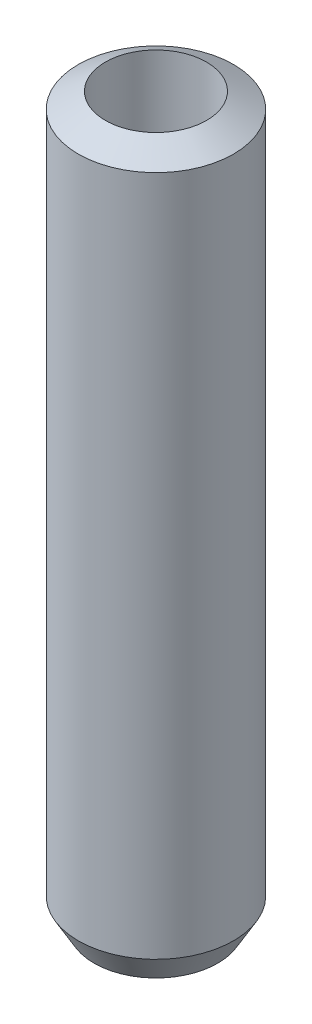
from build123d import *

# Parameters (mm, degrees)
SKETCH1_R           = 7.5
BOSS_EXTRUDE1_DEPTH = 69.977346
SKETCH2_R           = 4.887771224
CUT_EXTRUDE1_DEPTH  = 71.776613039
CHAMFER1_SIZE       = 1.524616
CHAMFER1_SIZE_2     = 2.640712


with BuildPart() as part:
    # Sketch1 → Boss-Extrude1 (new body)
    with BuildSketch(Plane(origin=(0, 0, 0), x_dir=(1, 0, 0), z_dir=(0, 1, 0))):
        with Locations(Location((0, 0, 0), (0, 0, 270))):
            Circle(SKETCH1_R)
    extrude(amount=BOSS_EXTRUDE1_DEPTH)

    # Sketch2 → Cut-Extrude1 (cut, through all)
    with BuildSketch(Plane(origin=(0, 0, 0), x_dir=(1, 0, 0), z_dir=(0, 1, 0))):
        with Locations(Location((0, 0, 0), (0, 0, 270))):
            Circle(SKETCH2_R)
    extrude(amount=CUT_EXTRUDE1_DEPTH, mode=Mode.SUBTRACT)

    # Chamfer1
    # the kernel refuses this chamfer: 2.640712, 1.524616 mm, written as the material it takes off along each edge
    with BuildSketch(Plane(origin=(0, 69.977346, 0), x_dir=(0, 0, 1), z_dir=(-1, 0, 0))) as chamfer1_piece_1:
        Polygon((7.5, -CHAMFER1_SIZE), (7.5 - CHAMFER1_SIZE_2, 0), (7.5, 0), align=None)
    revolve(axis=Axis((0, 69.977346, 0), (0, 1, 0)), mode=Mode.SUBTRACT)
    with BuildSketch(Plane(origin=(0, 0, 0), x_dir=(0, 0, 1), z_dir=(-1, 0, 0))) as chamfer1_piece_2:
        Polygon((7.5, CHAMFER1_SIZE_2), (7.5 - CHAMFER1_SIZE, 0), (7.5, 0), align=None)
    revolve(axis=Axis((0, 0, 0), (0, 1, 0)), mode=Mode.SUBTRACT)


solid = part.part
